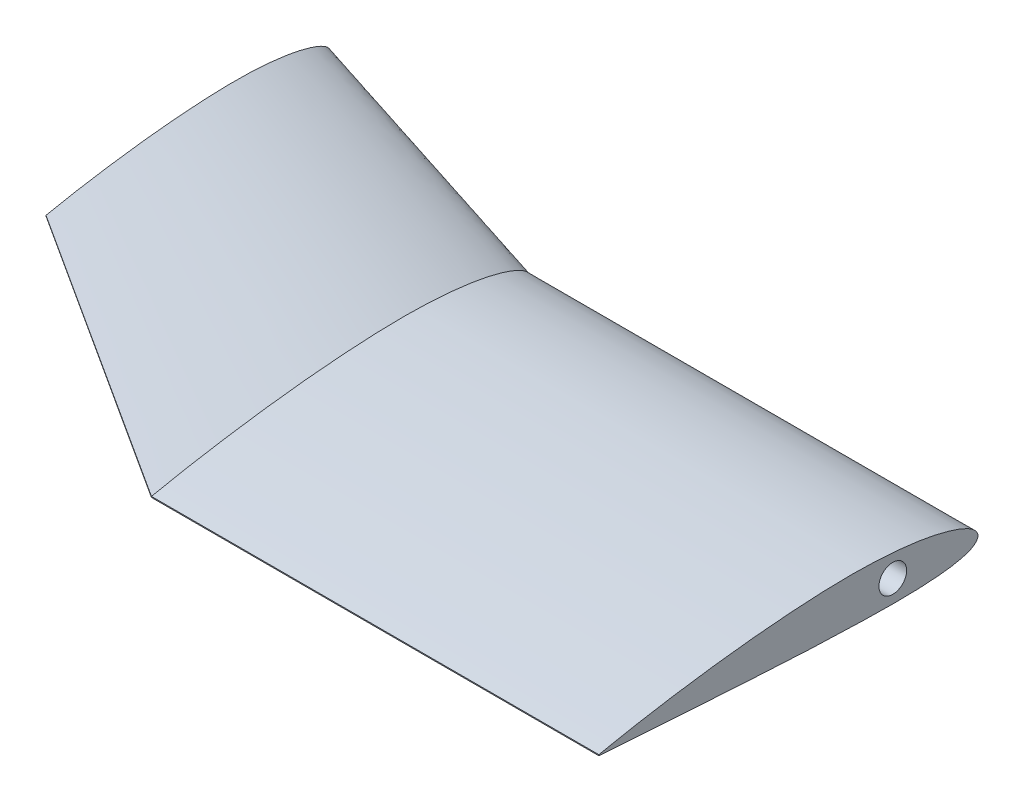
from build123d import *

# Parameters (mm, degrees)
EXTERIOR_DEPTH      = 89
BOSS_EXTRUDE1_DEPTH = 15
CUT_EXTRUDE1_DEPTH  = 187.402789831
BOSS_EXTRUDE2_DEPTH = 250
CUT_EXTRUDE3_DEPTH  = 3
SKETCH15_R          = 1.75
CUT_EXTRUDE4_DEPTH  = 4
CUT_EXTRUDE5_DEPTH  = 2.5
CUT_EXTRUDE6_DEPTH  = 267.949433541
BOSS_EXTRUDE3_DEPTH = 25
SKETCH20_R          = 3.25
CUT_EXTRUDE7_DEPTH  = 80
CUT_EXTRUDE8_DEPTH  = 199.051578191


with BuildPart() as part:
    # Sketch4 → Exterior (new body)
    with BuildSketch(Plane.XY):
        with BuildLine():
            Line((-30.310889132, 17.5), (30.310889132, 17.5))
            ThreePointArc((30.310889132, 17.5), (0, 35), (-30.310889132, 17.5))
        make_face()
    extrude(amount=EXTERIOR_DEPTH)

    # Sketch5 → Boss-Extrude1 (add)
    with BuildSketch(Plane(origin=(0, 0, 0), x_dir=(-1, 0, 0), z_dir=(0, 0, -1))):
        with BuildLine():
            Line((23.12466216, 17.5), (-23.12466216, 17.5))
            ThreePointArc((-23.12466216, 17.5), (0, 29), (23.12466216, 17.5))
        make_face()
    extrude(amount=BOSS_EXTRUDE1_DEPTH)

    # Sketch8 → Loft9 section 0
    with BuildSketch(Plane(origin=(80, 0, 0), x_dir=(0, 0, -1), z_dir=(1, 0, 0))):
        with BuildLine():
            Line((-89, 21.388673285), (-89, 21.157289024))
            add(Edge.make_bspline(
                [(-89, 21.388673285), (-87.517590216, 21.692439314), (-84.55666408, 22.299173554), (-78.629726947, 23.410490963), (-71.217063181, 24.641831569), (-62.315979948, 25.916239067), (-53.416365024, 26.979047829), (-44.512891772, 27.757252313), (-35.611446145, 28.284249753), (-28.184700481, 28.373454674), (-22.249157522, 28.127729724), (-17.793860325, 27.767671666), (-13.332938365, 27.197496306), (-9.62034211, 26.495369454), (-6.660587516, 25.701015566), (-4.416675535, 24.978830377), (-2.51552544, 24.137376162), (-0.875610556, 23.117206005), (0.554450875, 21.352966349), (-0.931001928, 19.802231536), (-2.540242561, 19.094955092), (-4.433028592, 18.557703614), (-6.669552992, 18.172492853), (-9.641153104, 17.843758377), (-13.350431468, 17.590735708), (-17.804318711, 17.489291467), (-22.255027214, 17.503428063), (-28.18850674, 17.634400274), (-35.606048519, 17.870077207), (-44.505998121, 18.280226492), (-53.403367011, 18.813318665), (-62.302244976, 19.367425301), (-71.202644497, 19.928300878), (-78.617203737, 20.444864827), (-84.55068004, 20.843300056), (-87.516825449, 21.052621243), (-89, 21.157289024)],
                knots=[0, 0, 0, 0, 0.02501249, 0.049959286, 0.099672925, 0.14920632, 0.198581097, 0.24780517, 0.296916575, 0.345952722, 0.370491626, 0.395091204, 0.419814796, 0.444798575, 0.457489819, 0.470406405, 0.483879409, 0.49126412, 0.503458853, 0.513609129, 0.520450991, 0.533235388, 0.545691039, 0.558031884, 0.582609167, 0.607134742, 0.63165208, 0.656174272, 0.705233949, 0.754320379, 0.803437364, 0.852566096, 0.901700994, 0.950848809, 0.975422717, 1, 1, 1, 1], degree=3))
        make_face()
    # Sketch9 → Loft9 section 1
    with BuildSketch(Plane(origin=(-80, 0, 0), x_dir=(0, 0, -1), z_dir=(1, 0, 0))):
        with BuildLine():
            Line((-89, 21.388673285), (-89, 21.157289024))
            add(Edge.make_bspline(
                [(-89, 21.388673285), (-87.517590216, 21.692439314), (-84.55666408, 22.299173554), (-78.629726947, 23.410490963), (-71.217063181, 24.641831569), (-62.315979948, 25.916239067), (-53.416365024, 26.979047829), (-44.512891772, 27.757252313), (-35.611446145, 28.284249753), (-28.184700481, 28.373454674), (-22.249157522, 28.127729724), (-17.793860325, 27.767671666), (-13.332938365, 27.197496306), (-9.62034211, 26.495369454), (-6.660587516, 25.701015566), (-4.416675535, 24.978830377), (-2.51552544, 24.137376162), (-0.875610556, 23.117206005), (0.554450875, 21.352966349), (-0.931001928, 19.802231536), (-2.540242561, 19.094955092), (-4.433028592, 18.557703614), (-6.669552992, 18.172492853), (-9.641153104, 17.843758377), (-13.350431468, 17.590735708), (-17.804318711, 17.489291467), (-22.255027214, 17.503428063), (-28.18850674, 17.634400274), (-35.606048519, 17.870077207), (-44.505998121, 18.280226492), (-53.403367011, 18.813318665), (-62.302244976, 19.367425301), (-71.202644497, 19.928300878), (-78.617203737, 20.444864827), (-84.55068004, 20.843300056), (-87.516825449, 21.052621243), (-89, 21.157289024)],
                knots=[0, 0, 0, 0, 0.02501249, 0.049959286, 0.099672925, 0.14920632, 0.198581097, 0.24780517, 0.296916575, 0.345952722, 0.370491626, 0.395091204, 0.419814796, 0.444798575, 0.457489819, 0.470406405, 0.483879409, 0.49126412, 0.503458853, 0.513609129, 0.520450991, 0.533235388, 0.545691039, 0.558031884, 0.582609167, 0.607134742, 0.63165208, 0.656174272, 0.705233949, 0.754320379, 0.803437364, 0.852566096, 0.901700994, 0.950848809, 0.975422717, 1, 1, 1, 1], degree=3))
        make_face()
    loft()

    # Sketch12 → Cut-Extrude1 (cut, through all)
    with BuildSketch(Plane(origin=(80, 0, 0), x_dir=(0, 0, -1), z_dir=(1, 0, 0))):
        with BuildLine():
            Line((-89, 21.388673285), (-97.240851338, 26.906548897))
            Line((-97.240851338, 26.906548897), (-90.292288108, 42.772216923))
            Line((-90.292288108, 42.772216923), (-30.113825381, 44.023328414))
            Line((-30.113825381, 44.023328414), (6.418630162, 38.518437853))
            Line((6.418630162, 38.518437853), (-0.009919735, 28.917510296))
            Line((-0.009919735, 28.917510296), (-30.620155213, 28.319719466))
            add(Edge.make_bspline(
                [(-89, 21.388673285), (-87.517590216, 21.692439314), (-84.55666408, 22.299173554), (-78.629726947, 23.410490963), (-71.217063181, 24.641831569), (-62.315979948, 25.916239067), (-53.416365024, 26.979047829), (-44.512891772, 27.757252313), (-36.914651442, 28.207095335), (-32.281666301, 28.310724955), (-30.620155213, 28.319719466)],
                knots=[0, 0, 0, 0, 0.02501249, 0.049959286, 0.099672925, 0.14920632, 0.198581097, 0.24780517, 0.296916575, 0.324376959, 0.324376959, 0.324376959, 0.324376959], degree=3))
        make_face()
    extrude(amount=-CUT_EXTRUDE1_DEPTH, mode=Mode.SUBTRACT)

    # Sketch17 → Boss-Extrude2 (add)
    with BuildSketch(Plane.ZY.offset(80)):
        with BuildLine():
            Line((89, 21.388673285), (89, 21.157289024))
            add(Edge.make_bspline(
                [(89, 21.388673285), (87.517590216, 21.692439314), (84.55666408, 22.299173554), (78.629726947, 23.410490963), (71.217063181, 24.641831569), (62.315979948, 25.916239067), (53.416365024, 26.979047829), (44.512891772, 27.757252313), (35.611446145, 28.284249753), (28.184700481, 28.373454674), (22.249157522, 28.127729724), (17.793860325, 27.767671666), (13.332938365, 27.197496306), (9.62034211, 26.495369454), (6.660587516, 25.701015566), (4.416675535, 24.978830377), (2.51552544, 24.137376162), (0.875610556, 23.117206005), (-0.554450875, 21.352966349), (0.931001928, 19.802231536), (2.540242561, 19.094955092), (4.433028592, 18.557703614), (6.669552992, 18.172492853), (9.641153104, 17.843758377), (13.350431468, 17.590735708), (17.804318711, 17.489291467), (22.255027214, 17.503428063), (28.18850674, 17.634400274), (35.606048519, 17.870077207), (44.505998121, 18.280226492), (53.403367011, 18.813318665), (62.302244976, 19.367425301), (71.202644497, 19.928300878), (78.617203737, 20.444864827), (84.55068004, 20.843300056), (87.516825449, 21.052621243), (89, 21.157289024)],
                knots=[0, 0, 0, 0, 0.02501249, 0.049959286, 0.099672925, 0.14920632, 0.198581097, 0.24780517, 0.296916575, 0.345952722, 0.370491626, 0.395091204, 0.419814796, 0.444798575, 0.457489819, 0.470406405, 0.483879409, 0.49126412, 0.503458853, 0.513609129, 0.520450991, 0.533235388, 0.545691039, 0.558031884, 0.582609167, 0.607134742, 0.63165208, 0.656174272, 0.705233949, 0.754320379, 0.803437364, 0.852566096, 0.901700994, 0.950848809, 0.975422717, 1, 1, 1, 1], degree=3))
        make_face()
    extrude(amount=BOSS_EXTRUDE2_DEPTH)

    # Sketch14 → Cut-Extrude3 (cut)
    with BuildSketch(Plane(origin=(0, 30, 0), x_dir=(1, 0, 0), z_dir=(0, 1, 0))):
        with BuildLine():
            Line((-65, -33.999999014), (-95, -33.999999014))
            ThreePointArc((-95, -33.999999014), (-101, -39.999999014), (-95, -45.999999014))
            Line((-95, -45.999999014), (-65, -45.999999014))
            ThreePointArc((-65, -45.999999014), (-59, -39.999999014), (-65, -33.999999014))
        make_face()
    cut_extrude3 = extrude(amount=-CUT_EXTRUDE3_DEPTH, mode=Mode.SUBTRACT)

    # Sketch15 → Cut-Extrude4 (cut)
    with BuildSketch(Plane(origin=(0, 27, 0), x_dir=(1, 0, 0), z_dir=(0, 1, 0))):
        with Locations((-65, -39.999999014)):
            Circle(SKETCH15_R)
        with Locations((-95, -39.999999014)):
            Circle(SKETCH15_R)
    cut_extrude4 = extrude(amount=-CUT_EXTRUDE4_DEPTH, mode=Mode.SUBTRACT)

    # Sketch16 → Cut-Extrude5 (cut)
    with BuildSketch(Plane(origin=(0, 23.5, 0), x_dir=(1, 0, 0), z_dir=(0, 1, 0))):
        Polygon((-67.165063509, -43.749999014), (-62.834936491, -43.749999014), (-60.669872981, -39.999999014), (-62.834936491, -36.249999014), (-67.165063509, -36.249999014), (-69.330127019, -39.999999014), align=None)
        Polygon((-90.669872981, -39.999999014), (-92.834936491, -43.749999014), (-97.165063509, -43.749999014), (-99.330127019, -39.999999014), (-97.165063509, -36.249999014), (-92.834936491, -36.249999014), align=None)
    cut_extrude5 = extrude(amount=CUT_EXTRUDE5_DEPTH, mode=Mode.SUBTRACT)

    # Mirror1: Cut-Extrude3, Cut-Extrude4, Cut-Extrude5 across plane
    add(cut_extrude3.mirror(Plane(origin=(0, 0, 0), x_dir=(0, 0, 1), z_dir=(1, 0, 0))), mode=Mode.SUBTRACT)
    add(cut_extrude4.mirror(Plane(origin=(0, 0, 0), x_dir=(0, 0, 1), z_dir=(1, 0, 0))), mode=Mode.SUBTRACT)
    add(cut_extrude5.mirror(Plane(origin=(0, 0, 0), x_dir=(0, 0, 1), z_dir=(1, 0, 0))), mode=Mode.SUBTRACT)

    # Sketch18 → Cut-Extrude6 (cut, through all)
    with BuildSketch(Plane(origin=(-80, 0, 0), x_dir=(0, 0, -1), z_dir=(1, 0, 0))):
        Polygon((-99.866971184, 5.715372229), (-104.390100049, 63.325750406), (31.898914441, 60.82612656), (39.278756274, -3.211855795), align=None)
    extrude(amount=CUT_EXTRUDE6_DEPTH, mode=Mode.SUBTRACT)

    # Sketch19 → Boss-Extrude3 (add)
    with BuildSketch(Plane.ZY.offset(330)):
        with BuildLine():
            Line((89, 21.388673285), (89, 21.157289024))
            add(Edge.make_bspline(
                [(89, 21.388673285), (87.517590216, 21.692439314), (84.55666408, 22.299173554), (78.629726947, 23.410490963), (71.217063181, 24.641831569), (62.315979948, 25.916239067), (53.416365024, 26.979047829), (44.512891772, 27.757252313), (35.611446145, 28.284249753), (28.184700481, 28.373454674), (22.249157522, 28.127729724), (17.793860325, 27.767671666), (13.332938365, 27.197496306), (9.62034211, 26.495369454), (6.660587516, 25.701015566), (4.416675535, 24.978830377), (2.51552544, 24.137376162), (0.875610556, 23.117206005), (-0.554450875, 21.352966349), (0.931001928, 19.802231536), (2.540242561, 19.094955092), (4.433028592, 18.557703614), (6.669552992, 18.172492853), (9.641153104, 17.843758377), (13.350431468, 17.590735708), (17.804318711, 17.489291467), (22.255027214, 17.503428063), (28.18850674, 17.634400274), (35.606048519, 17.870077207), (44.505998121, 18.280226492), (53.403367011, 18.813318665), (62.302244976, 19.367425301), (71.202644497, 19.928300878), (78.617203737, 20.444864827), (84.55068004, 20.843300056), (87.516825449, 21.052621243), (89, 21.157289024)],
                knots=[0, 0, 0, 0, 0.02501249, 0.049959286, 0.099672925, 0.14920632, 0.198581097, 0.24780517, 0.296916575, 0.345952722, 0.370491626, 0.395091204, 0.419814796, 0.444798575, 0.457489819, 0.470406405, 0.483879409, 0.49126412, 0.503458853, 0.513609129, 0.520450991, 0.533235388, 0.545691039, 0.558031884, 0.582609167, 0.607134742, 0.63165208, 0.656174272, 0.705233949, 0.754320379, 0.803437364, 0.852566096, 0.901700994, 0.950848809, 0.975422717, 1, 1, 1, 1], degree=3))
        make_face()
    extrude(amount=BOSS_EXTRUDE3_DEPTH)

    # Sketch20 → Cut-Extrude7 (cut)
    with BuildSketch(Plane(origin=(-250, 0, 0), x_dir=(0, 0, -1), z_dir=(1, 0, 0))):
        with Locations((-20, 22.719194586)):
            Circle(SKETCH20_R)
    extrude(amount=-CUT_EXTRUDE7_DEPTH, mode=Mode.SUBTRACT)

    # Sketch21 → section 1 of loft10
    with BuildSketch(Plane(origin=(-402, 0, 0), x_dir=(0, 0, -1), z_dir=(1, 0, 0)), mode=Mode.PRIVATE) as loft10_s1:
        with BuildLine():
            Line((-66.749885652, 43.883272144), (-66.750114348, 43.709734249))
            add(Edge.make_bspline(
                [(-66.749885652, 43.883272144), (-65.637780008, 44.109631083), (-63.416489577, 44.561754447), (-58.970196042, 45.389382979), (-53.409490838, 46.305560288), (-46.732430406, 47.252566583), (-40.056680345, 48.040875552), (-33.378317839, 48.61572787), (-26.701724339, 49.002177237), (-21.131586596, 49.061740351), (-16.680179978, 48.871580376), (-13.339068758, 48.597133767), (-9.993946649, 48.165093895), (-7.210198263, 47.634830208), (-4.991171298, 47.03614046), (-3.30895403, 46.492284666), (-1.883925613, 45.859316039), (-0.654999903, 45.092568888), (0.415800565, 43.767977997), (-0.699819821, 42.606397102), (-1.907447259, 42.077531234), (-3.327565326, 41.676464121), (-5.005336448, 41.389767092), (-7.234357577, 41.146153739), (-10.016561602, 40.96005325), (-13.357071498, 40.888372342), (-16.695083106, 40.90337377), (-21.145055571, 41.007467301), (-26.707969305, 41.191556057), (-33.38251453, 41.507964036), (-40.055002709, 41.916576469), (-46.728601924, 42.340951212), (-53.403335612, 42.770404158), (-58.963734822, 43.165154862), (-63.413440515, 43.469845305), (-65.637838818, 43.629767607), (-66.750114348, 43.709734249)],
                knots=[0, 0, 0, 0, 0.02501249, 0.049959286, 0.099672925, 0.14920632, 0.198581097, 0.24780517, 0.296916575, 0.345952722, 0.370491626, 0.395091204, 0.419814796, 0.444798575, 0.457489819, 0.470406405, 0.483879409, 0.49126412, 0.503458853, 0.513609129, 0.520450991, 0.533235388, 0.545691039, 0.558031884, 0.582609167, 0.607134742, 0.63165208, 0.656174272, 0.705233949, 0.754320379, 0.803437364, 0.852566096, 0.901700994, 0.950848809, 0.975422717, 1, 1, 1, 1], degree=3))
        make_face()
    # loft from a face of the part (loft10)
    loft([part.faces().sort_by_distance((-355, 22.712265213, 37.706170127))[0], loft10_s1.sketch])

    # Sketch22 → Cut-Extrude8 (cut, through all)
    with BuildSketch(Plane(origin=(-250, 0, 0), x_dir=(0, 0, -1), z_dir=(1, 0, 0))):
        Polygon((-115.189774778, 57.109996335), (45.679371542, 59.96989227), (47.824293493, -10.812532111), (-124.722761227, -9.501746474), align=None)
    extrude(amount=CUT_EXTRUDE8_DEPTH, mode=Mode.SUBTRACT)


solid = part.part
